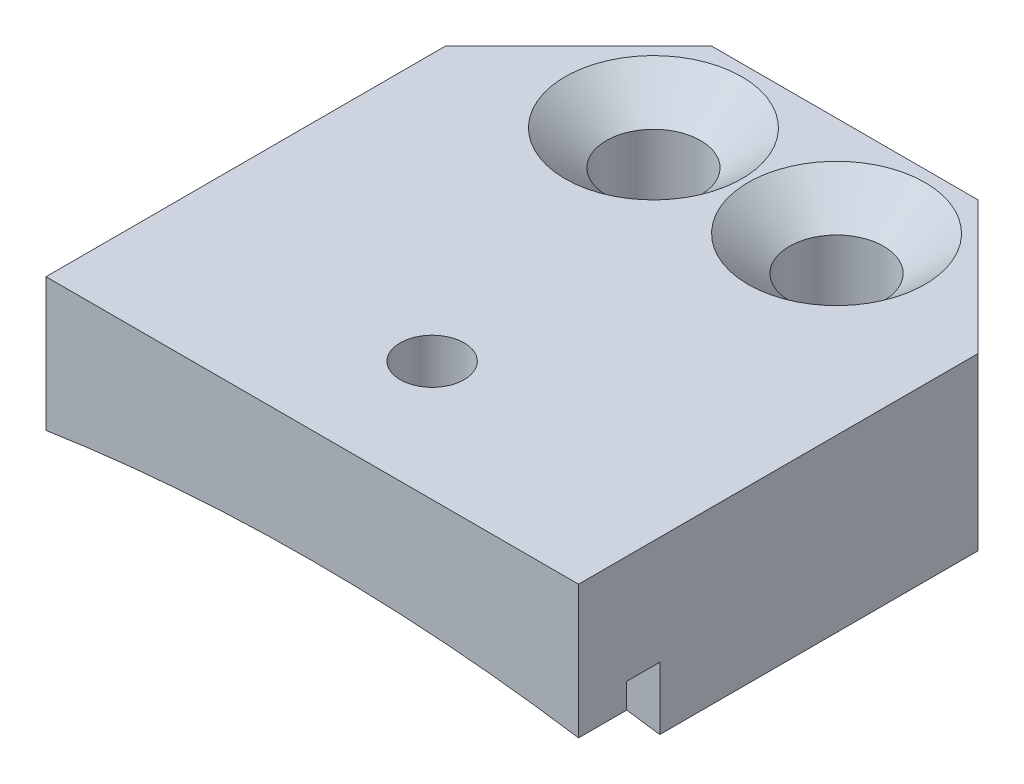
from build123d import *

# Parameters (mm, degrees)
BOSS_EXTRUDE1_DEPTH                               = 6.35
CUT_EXTRUDE1_DEPTH                                = 39.709258643
CUT_EXTRUDE1_DEPTH_BACK                           = 39.709258643
SKETCH2_R                                         = 83.82
BOSS_EXTRUDE2_DEPTH                               = 22.225
CHAMFER1_SIZE                                     = 6.35
CSK_FOR_8_FLAT_HEAD_MACHINE_SCREW_100_D           = 4.4958
CSK_FOR_8_FLAT_HEAD_MACHINE_SCREW_100_CSINK_D     = 8.4328
CSK_FOR_8_FLAT_HEAD_MACHINE_SCREW_100_CSINK_ANGLE = 100
SKETCH6_R                                         = 1.524
CUT_EXTRUDE2_DEPTH                                = 33.316173568
SKETCH7_W                                         = 1.5875
SKETCH7_H                                         = 2.989850087
CUT_EXTRUDE3_DEPTH                                = 30.163050233


with BuildPart() as part:
    # Sketch1 → Boss-Extrude1 (new body)
    with BuildSketch(Plane(origin=(0, 0, 0), x_dir=(1, 0, 0), z_dir=(0, 1, 0))):
        Polygon((-28.511825699, 6.495271113), (-22.161825699, 12.845271113), (-9.461825699, 12.845271113), (-3.111825699, 6.495271113), (-3.111825699, -12.554728887), (-28.511825699, -12.554728887), align=None)
    extrude(amount=BOSS_EXTRUDE1_DEPTH)

    # Sketch2 → Cut-Extrude1 (cut, two sides: drawn at the far end of the back side and taken through both)
    with BuildSketch(Plane.XY.offset(12.554728887).offset(-CUT_EXTRUDE1_DEPTH_BACK)):
        with Locations((-15.811825699, -82.852292666)):
            Circle(SKETCH2_R)
    extrude(amount=CUT_EXTRUDE1_DEPTH + CUT_EXTRUDE1_DEPTH_BACK, mode=Mode.SUBTRACT)

    # Sketch5 → Boss-Extrude2 (add)
    with BuildSketch(Plane(origin=(0, 0, -12.845271113), x_dir=(-1, 0, 0), z_dir=(0, 0, -1))):
        with BuildLine():
            Line((3.111825699, 6.35), (3.111825699, 0))
            Line((3.111825699, 0), (3.111825699, -1.799225087))
            ThreePointArc((3.111825699, -1.799225087), (15.811825699, -0.810292666), (28.511825699, -1.799225087))
            Line((28.511825699, -1.799225087), (28.511825699, 0))
            Line((28.511825699, 0), (28.511825699, 6.35))
            Line((28.511825699, 6.35), (3.111825699, 6.35))
        make_face()
    extrude(amount=-BOSS_EXTRUDE2_DEPTH)

    # Chamfer1
    chamfer1_edges = [part.edges().sort_by_distance(p)[0] for p in [
        (-28.511825699, 2.275387457, -12.845271113),
        (-3.111825699, 2.275387457, -12.845271113),
    ]]
    chamfer(chamfer1_edges, length=CHAMFER1_SIZE)

    # CSK for #8 Flat Head Machine Screw (100)1 (through all)
    with Locations(Plane(origin=(0, 6.35, 0), x_dir=(1, 0, 0), z_dir=(0, 1, 0))):
        with Locations((-20.177450699, 8.082771113), (-11.446200699, 8.082771113)):
            CounterSinkHole(CSK_FOR_8_FLAT_HEAD_MACHINE_SCREW_100_D / 2, CSK_FOR_8_FLAT_HEAD_MACHINE_SCREW_100_CSINK_D / 2, counter_sink_angle=CSK_FOR_8_FLAT_HEAD_MACHINE_SCREW_100_CSINK_ANGLE)

    # Sketch6 → Cut-Extrude2 (cut, through all)
    with BuildSketch(Plane(origin=(0, 6.35, 0), x_dir=(1, 0, 0), z_dir=(0, 1, 0))):
        with Locations((-15.810195404, -6.839728887)):
            Circle(SKETCH6_R)
    extrude(amount=-CUT_EXTRUDE2_DEPTH, mode=Mode.SUBTRACT)

    # Sketch7 → Cut-Extrude3 (cut, through all)
    with BuildSketch(Plane(origin=(-3.111825699, 0, 0), x_dir=(0, 0, -1), z_dir=(1, 0, 0))):
        with Locations((-9.474978887, -0.304300044)):
            Rectangle(SKETCH7_W, SKETCH7_H)
    extrude(amount=-CUT_EXTRUDE3_DEPTH, mode=Mode.SUBTRACT)


solid = part.part
